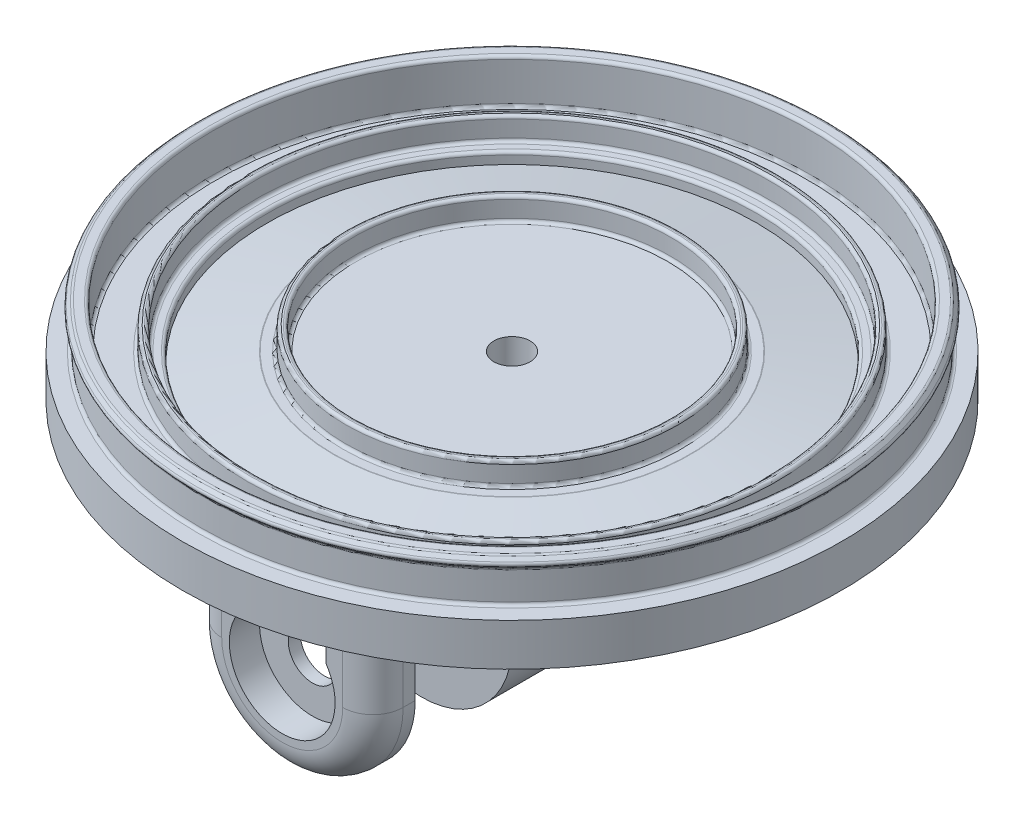
from build123d import *

# Parameters (mm, degrees)
SKETCH2_R                = 54.5
BOSS_EXTRUDE1_DEPTH      = 7
SKETCH4_R                = 43.75
SKETCH4_R_2              = 42.5
SKETCH4_R_3              = 27.5
SKETCH4_R_4              = 26.25
BOSS_EXTRUDE2_DEPTH      = 3.723
FILLET1_R                = 0.5
FILLET2_R                = 0.5
SKETCH6_R                = 3
CUT_EXTRUDE1_DEPTH       = 6
BOSS_EXTRUDE3_DEPTH      = 15
BOSS_EXTRUDE3_DEPTH_BACK = 15
SKETCH7_R                = 4
CUT_EXTRUDE4_DEPTH       = 5
CUT_EXTRUDE4_DEPTH_BACK  = 5
SKETCH10_W               = 38.473117609
SKETCH10_H               = 42.182403499
BOSS_EXTRUDE4_START      = 16
SKETCH11_R               = 4
BOSS_EXTRUDE4_DEPTH      = 2
BOSS_EXTRUDE5_DEPTH      = 5
FILLET3_R                = 5


with BuildPart() as part:
    # Sketch2 → Boss-Extrude1 (new body)
    with BuildSketch(Plane(origin=(0, 0, 0), x_dir=(1, 0, 0), z_dir=(0, 1, 0))):
        Circle(SKETCH2_R)
    extrude(amount=BOSS_EXTRUDE1_DEPTH)

    # Sketch3 → Cut-Revolve1 (revolve, cut)
    with BuildSketch(Plane.XY):
        Polygon((-29.5, 7), (-40.5, 7), (-40.5, 5.127), align=None)
    revolve(axis=Axis((0, 0, 0), (0, 1, 0)), mode=Mode.SUBTRACT)

    # Sketch4 → Boss-Extrude2 (add)
    # profile 1 of 2: a face of its own
    with BuildSketch(Plane(origin=(0, 7, 0), x_dir=(1, 0, 0), z_dir=(0, 1, 0))):
        Circle(SKETCH4_R)
        Circle(SKETCH4_R_2, mode=Mode.SUBTRACT)
    # profile 2 of 2: a face of its own
    with BuildSketch(Plane(origin=(0, 7, 0), x_dir=(1, 0, 0), z_dir=(0, 1, 0))):
        Circle(SKETCH4_R_3)
        Circle(SKETCH4_R_4, mode=Mode.SUBTRACT)
    extrude(amount=BOSS_EXTRUDE2_DEPTH)

    # Fillet1
    fillet1_edges = [part.edges().sort_by_distance(p)[0] for p in [
        (-26.25, 7, 0),
        (29.5, 7, 0),
        (40.5, 7, 0),
        (-43.75, 10.723, 0),
        (-42.5, 7, 0),
        (-42.5, 10.723, 0),
        (-27.5, 7, 0),
        (-27.5, 10.723, 0),
        (-26.25, 10.723, 0),
        (-43.75, 7, 0),
    ]]
    fillet(fillet1_edges, radius=FILLET1_R)

    # Sketch5 → Revolve1 (revolve)
    with BuildSketch(Plane.XY):
        Polygon((-49.5, 7), (-51.5, 7), (-51.5, 12.323), (-52.5, 13.323), (-51.5, 14.323), (-49.5, 14.323), align=None)
    revolve(axis=Axis((0, 7, 0), (0, 1, 0)))

    # Fillet2
    fillet2_edges = [part.edges().sort_by_distance(p)[0] for p in [
        (51.5, 7, 0),
        (49.5, 7, 0),
        (49.5, 14.323, 0),
        (51.5, 14.323, 0),
        (51.5, 12.323, 0),
        (52.5, 13.323, 0),
    ]]
    fillet(fillet2_edges, radius=FILLET2_R)

    # Sketch6 → Cut-Extrude1 (cut)
    with BuildSketch(Plane(origin=(0, 7, 0), x_dir=(1, 0, 0), z_dir=(0, 1, 0))):
        Circle(SKETCH6_R)
    extrude(amount=-CUT_EXTRUDE1_DEPTH, mode=Mode.SUBTRACT)

    # Sketch7 → Boss-Extrude3 (add, two sides: drawn at the far end of the back side and taken through both)
    with BuildSketch(Plane.XY.offset(-BOSS_EXTRUDE3_DEPTH_BACK)):
        with BuildLine():
            Line((15, 0), (-15, 0))
            Line((-15, 0), (-15, -20))
            ThreePointArc((-15, -20), (0, -35), (15, -20))
            Line((15, -20), (15, 0))
        make_face()
        with Locations((0, -20)):
            Circle(SKETCH7_R, mode=Mode.SUBTRACT)
    extrude(amount=BOSS_EXTRUDE3_DEPTH + BOSS_EXTRUDE3_DEPTH_BACK)

    # Sketch10 → Cut-Extrude4 (cut, two sides: drawn at the far end of the back side and taken through both)
    with BuildSketch(Plane.XY.offset(-CUT_EXTRUDE4_DEPTH_BACK)):
        with Locations((1.71649294, -21.09120175)):
            Rectangle(SKETCH10_W, SKETCH10_H)
    extrude(amount=CUT_EXTRUDE4_DEPTH + CUT_EXTRUDE4_DEPTH_BACK, mode=Mode.SUBTRACT)

    # Sketch11 → Boss-Extrude4 (add)
    with BuildSketch(Plane.XY.offset(15).offset(BOSS_EXTRUDE4_START)):
        with BuildLine():
            Line((15, -20), (15, 0))
            Line((15, 0), (-15, 0))
            Line((-15, 0), (-15, -20))
            ThreePointArc((-15, -20), (0, -35), (15, -20))
        make_face()
        with Locations((0, -20)):
            Circle(SKETCH11_R, mode=Mode.SUBTRACT)
    extrude(amount=BOSS_EXTRUDE4_DEPTH)

    # Sketch12 → Boss-Extrude5 (add)
    with BuildSketch(Plane.XY.offset(33)):
        with BuildLine():
            Line((-7.25, -15.101020514), (-7.25, 0))
            Line((-7.25, 0), (-15, 0))
            Line((-15, 0), (-15, -20))
            ThreePointArc((-15, -20), (0, -35), (15, -20))
            Line((15, -20), (15, 0))
            Line((15, 0), (7.25, 0))
            Line((7.25, 0), (7.25, -15.101020514))
            ThreePointArc((7.25, -15.101020514), (8.366600265, -17.438262309), (8.75, -20))
            ThreePointArc((8.75, -20), (-2.561737691, -28.366600265), (-7.25, -15.101020514))
        make_face()
    extrude(amount=BOSS_EXTRUDE5_DEPTH)

    # Fillet3
    fillet3_edges = [part.edges().sort_by_distance(p)[0] for p in [
        (-15, -10, 38),
        (0, -35, 38),
        (15, -10, 38),
    ]]
    fillet(fillet3_edges, radius=FILLET3_R)
    fillet3_2_edges = [part.edges().sort_by_distance(p)[0] for p in [
        (8.625, 0, 38),
    ]]
    fillet(fillet3_2_edges, radius=FILLET3_R)
    fillet3_3_edges = [part.edges().sort_by_distance(p)[0] for p in [
        (-8.625, 0, 38),
    ]]
    fillet(fillet3_3_edges, radius=FILLET3_R)


solid = part.part
